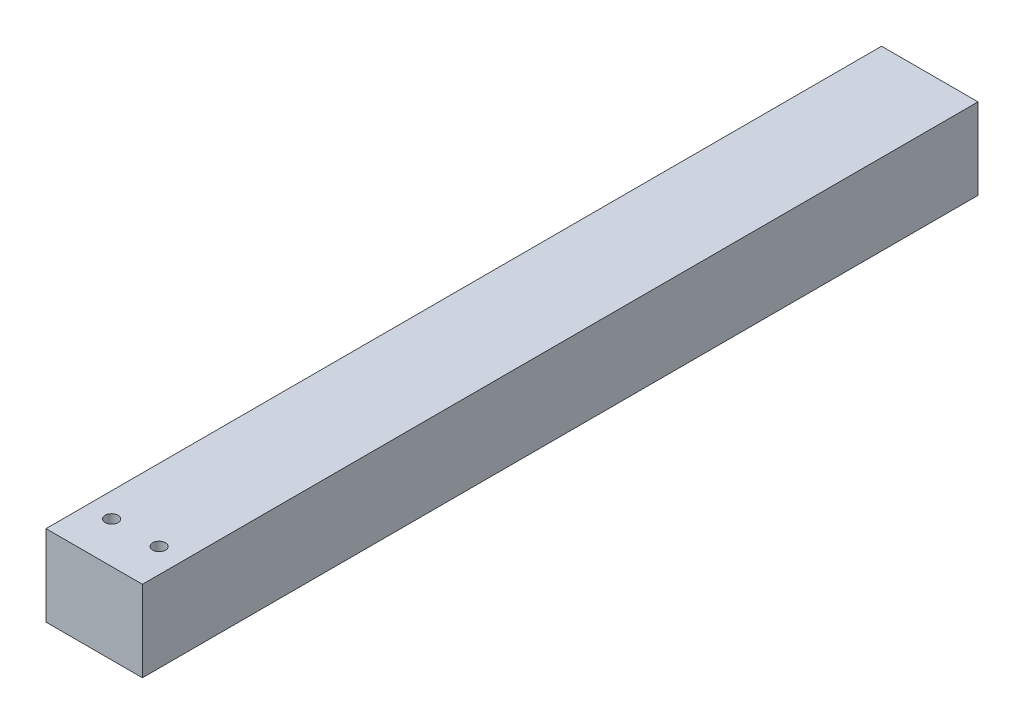
from build123d import *

# Parameters (mm, degrees)
ESQUISSE1_W             = 75
ESQUISSE1_H             = 63
BOSS_EXTRU_1_DEPTH      = 650
ESQUISSE2_R             = 5
ENL_V_MAT_EXTRU_1_DEPTH = 658.338573339


with BuildPart() as part:
    # Esquisse1 → Boss.-Extru.1 (new body)
    with BuildSketch(Plane.XY):
        with Locations((37.5, 31.5)):
            Rectangle(ESQUISSE1_W, ESQUISSE1_H)
    extrude(amount=BOSS_EXTRU_1_DEPTH)

    # Esquisse2 → Enlèv. mat.-Extru.1 (cut, through all)
    with BuildSketch(Plane.XZ):
        with Locations((19, 618)):
            Circle(ESQUISSE2_R)
        with Locations((56, 618)):
            Circle(ESQUISSE2_R)
    extrude(amount=-ENL_V_MAT_EXTRU_1_DEPTH, mode=Mode.SUBTRACT)


solid = part.part
